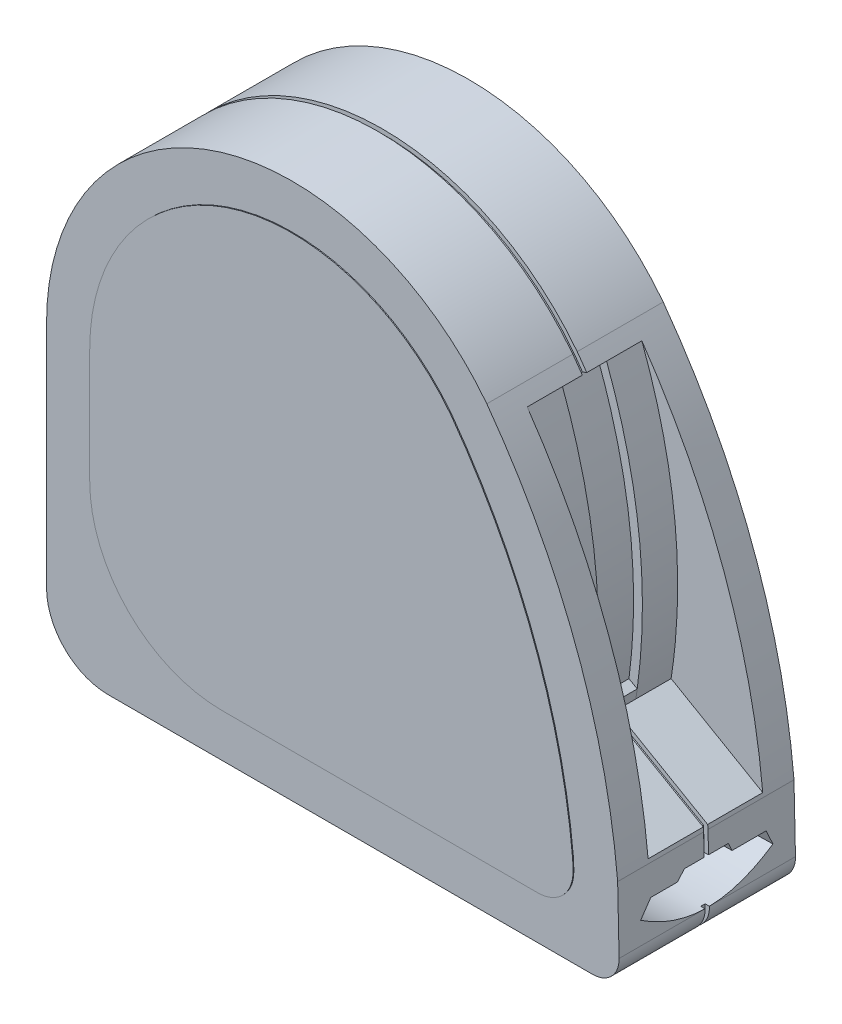
from build123d import *

# Parameters (mm, degrees)
BOSS_EXTRUDE1_DEPTH = 20
CUT_EXTRUDE1_START  = -10
CUT_EXTRUDE1_DEPTH  = 10
SKETCH3_R           = 1
BOSS_EXTRUDE2_DEPTH = 11
CUT_EXTRUDE2_DEPTH  = 48
CUT_EXTRUDE3_START  = -4
CUT_EXTRUDE3_DEPTH  = 4
CUT_EXTRUDE4_START  = -5
CUT_EXTRUDE4_DEPTH  = 5
CUT_EXTRUDE5_START  = -4
CUT_EXTRUDE5_DEPTH  = 4
CUT_EXTRUDE6_START  = -0.5
CUT_EXTRUDE6_DEPTH  = 0.5
SKETCH10_W          = 11.881943506
SKETCH10_H          = 0.5
CUT_EXTRUDE8_DEPTH  = 0.5
SKETCH13_R          = 2.5
BOSS_EXTRUDE4_DEPTH = 0.5
CUT_EXTRUDE11_DEPTH = 0.5
FILLET1_R           = 4.5
BOSS_EXTRUDE6_DEPTH = 0.25
BOSS_EXTRUDE7_DEPTH = 0.1


with BuildPart() as part:
    # Sketch1 → Boss-Extrude1 (new body)
    with BuildSketch(Plane.XY):
        with BuildLine():
            Line((-3.067227503, 0), (-58, 0))
            ThreePointArc((-58, 0), (-62.949747468, 2.050252532), (-65, 7))
            Line((-65, 7), (-65, 33))
            ThreePointArc((-65, 33), (-46.129115171, 59.379890402), (-15.068017417, 50.040879846))
            ThreePointArc((-15.068017417, 50.040879846), (-4.964589361, 31.296635474), (-0.233494874, 10.535067603))
            Line((-0.233494874, 10.535067603), (-0.067964069, 3.066474432))
            ThreePointArc((-0.067964069, 3.066474432), (-0.922533668, 0.902313572), (-3.067227503, 0))
        make_face()
    extrude(amount=BOSS_EXTRUDE1_DEPTH)

    # Sketch2 → Cut-Extrude1 (cut)
    with BuildSketch(Plane.XY.offset(15).offset(CUT_EXTRUDE1_START)):
        with BuildLine():
            Line((-62, 7), (-65, 7))
            ThreePointArc((-65, 7), (-62.949747468, 2.050252532), (-58, 0))
            Line((-58, 0), (-58, 3))
            ThreePointArc((-58, 3), (-60.828427125, 4.171572875), (-62, 7))
        make_face()
    extrude(amount=CUT_EXTRUDE1_DEPTH, mode=Mode.SUBTRACT)

    # Sketch3 → Boss-Extrude2 (add)
    with BuildSketch(Plane.XY.offset(5)):
        with Locations((-61.889087297, 3.110912703)):
            Circle(SKETCH3_R)
    extrude(amount=BOSS_EXTRUDE2_DEPTH)

    # Sketch4 → Cut-Extrude2 (cut)
    with BuildSketch(Plane(origin=(0, 0, 0), x_dir=(0, 0, -1), z_dir=(0.9997544781853775, 0.02215814406225341, 0))):
        with BuildLine():
            Line((-16.31638175, 7.173372755), (-13.277275607, 7.173372755))
            Line((-13.277275607, 7.173372755), (-12.5, 8.067227503))
            Line((-12.5, 8.067227503), (-7.5, 8.067227503))
            Line((-7.5, 8.067227503), (-7.097765363, 7.173372755))
            Line((-7.097765363, 7.173372755), (-3.237538434, 7.173372755))
            Line((-3.237538434, 7.173372755), (-2.5, 5.534398458))
            add(Edge.make_bspline(
                [(-2.5, 5.534398458), (-10, 0.600056549), (-17.5, 5.534398458)],
                knots=[0, 0, 0, 1, 1, 1], degree=2))
            Line((-17.5, 5.534398458), (-16.31638175, 7.173372755))
        make_face()
    extrude(amount=-CUT_EXTRUDE2_DEPTH, mode=Mode.SUBTRACT)

    # Sketch5 → Cut-Extrude3 (cut)
    with BuildSketch(Plane.XY.offset(16.5).offset(CUT_EXTRUDE3_START)):
        with BuildLine():
            Line((-10.668622774, 17), (-0.276317928, 11))
            ThreePointArc((-0.276317928, 11), (-4.721665164, 30.640901571), (-13.987593056, 48.520183068))
            add(Edge.make_bspline(
                [(-10.668622774, 17), (-8.185258464, 32.996979826), (-13.987593056, 48.520183068)],
                knots=[0, 0, 0, 0.998403777, 0.998403777, 0.998403777], degree=2))
        make_face()
    extrude(amount=CUT_EXTRUDE3_DEPTH, mode=Mode.SUBTRACT)

    # Sketch7 → Cut-Extrude4 (cut)
    with BuildSketch(Plane.XY.offset(12.5).offset(CUT_EXTRUDE4_START)):
        with BuildLine():
            Line((-13.987593056, 48.520183068), (-14.924295987, 48.17005792))
            add(Edge.make_bspline(
                [(-11.448620959, 18.605032701), (-10.822746073, 23.362936066), (-10.757337335, 28.083756583), (-11.79521716, 37.940476985), (-13.018097552, 43.07033379), (-14.924295987, 48.17005792)],
                knots=[0.046122426, 0.046122426, 0.046122426, 0.046122426, 0.5, 0.5, 1, 1, 1, 1], degree=3))
            Line((-11.448620959, 18.605032701), (-10.512464367, 18.064542441))
            add(Edge.make_bspline(
                [(-10.668622774, 17), (-10.585952463, 17.53253374), (-10.512464367, 18.064542441)],
                knots=[0, 0, 0, 1, 1, 1], degree=2))
            Line((-10.668622774, 17), (-0.902736822, 11.361663117))
            Line((-0.902736822, 11.361663117), (-0.276317928, 11))
            ThreePointArc((-0.276317928, 11), (-4.721665164, 30.640901571), (-13.987593056, 48.520183068))
        make_face()
    extrude(amount=CUT_EXTRUDE4_DEPTH, mode=Mode.SUBTRACT)

    # Sketch8 → Cut-Extrude5 (cut)
    with BuildSketch(Plane.XY.offset(7.5).offset(CUT_EXTRUDE5_START)):
        with BuildLine():
            Line((-0.276317928, 11), (-10.668622774, 17))
            add(Edge.make_bspline(
                [(-10.668622774, 17), (-8.185258464, 32.996979826), (-13.987593056, 48.520183068)],
                knots=[0, 0, 0, 1, 1, 1], degree=2))
            ThreePointArc((-13.987593056, 48.520183068), (-4.721665164, 30.640901571), (-0.276317928, 11))
        make_face()
    extrude(amount=CUT_EXTRUDE5_DEPTH, mode=Mode.SUBTRACT)

    # Sketch9 → Cut-Extrude6 (cut)
    with BuildSketch(Plane.XY.offset(10.25).offset(CUT_EXTRUDE6_START)):
        with BuildLine():
            Line((-65, 33), (-65, 7))
            ThreePointArc((-65, 7), (-62.949747468, 2.050252532), (-58, 0))
            Line((-58, 0), (-3.067227503, 0))
            ThreePointArc((-3.067227503, 0), (-0.922533668, 0.902313572), (-0.067964069, 3.066474432))
            Line((-0.067964069, 3.066474432), (-0.233494874, 10.535067603))
            ThreePointArc((-0.233494874, 10.535067603), (-4.964589361, 31.296635474), (-15.068017417, 50.040879846))
            ThreePointArc((-15.068017417, 50.040879846), (-46.129115171, 59.379890402), (-65, 33))
        make_face()
        with BuildLine():
            Line((-0.567841308, 3.05539536), (-0.733001722, 10.507276848))
            ThreePointArc((-0.733001722, 10.507276848), (-5.43436068, 31.125352083), (-15.468000097, 49.740772639))
            ThreePointArc((-15.468000097, 49.740772639), (-45.97095186, 58.905551929), (-64.5, 33))
            Line((-64.5, 33), (-64.5, 7))
            ThreePointArc((-64.5, 7), (-62.596194078, 2.403805922), (-58, 0.5))
            Line((-58, 0.5), (-3.067227503, 0.5))
            ThreePointArc((-3.067227503, 0.5), (-1.27998264, 1.251927976), (-0.567841308, 3.05539536))
        make_face(mode=Mode.SUBTRACT)
    extrude(amount=CUT_EXTRUDE6_DEPTH, mode=Mode.SUBTRACT)

    # Sketch10 → Cut-Extrude8 (cut)
    with BuildSketch(Plane(origin=(4.694060239, 8.130350827, 0), x_dir=(0.8660254037844382, -0.500000000000001, 0), z_dir=(0.5000000000000009, 0.866025403784438, 0))):
        with Locations((-11.798326593, -10)):
            Rectangle(SKETCH10_W, SKETCH10_H)
    extrude(amount=-CUT_EXTRUDE8_DEPTH, mode=Mode.SUBTRACT)

    # Sketch13 → Boss-Extrude4 (add)
    with BuildSketch(Plane(origin=(0, 0, 0), x_dir=(-1, 0, 0), z_dir=(0, 0, -1))):
        with Locations((9.223846096, 10)):
            Circle(SKETCH13_R)
        with Locations((59.223846096, 10)):
            Circle(SKETCH13_R)
    extrude(amount=BOSS_EXTRUDE4_DEPTH)

    # Sketch14 → Cut-Extrude11 (cut)
    with BuildSketch(Plane(origin=(0, 0, -0.5), x_dir=(-1, 0, 0), z_dir=(0, 0, -1))):
        Polygon((8.973846096, 11.75), (9.473846096, 11.75), (9.473846096, 10.25), (10.973846096, 10.25), (10.973846096, 9.75), (9.473846096, 9.75), (9.473846096, 8.25), (8.973846096, 8.25), (8.973846096, 9.75), (7.473846096, 9.75), (7.473846096, 10.25), (8.973846096, 10.25), align=None)
        Polygon((60.973846096, 9.75), (59.473846096, 9.75), (59.473846096, 8.25), (58.973846096, 8.25), (58.973846096, 9.75), (57.473846096, 9.75), (57.473846096, 10.25), (58.973846096, 10.25), (58.973846096, 11.75), (59.473846096, 11.75), (59.473846096, 10.25), (60.973846096, 10.25), align=None)
    extrude(amount=-CUT_EXTRUDE11_DEPTH, mode=Mode.SUBTRACT)

    # Fillet1
    # the kernel refuses this fillet: 4.5 mm, written as the material it takes off along each edge
    with BuildSketch(Plane(origin=(-59.223846096, 10, -0.5), x_dir=(-1, 0, 0), z_dir=(0, -1, 0))) as fillet1_piece_1:
        with BuildLine():
            CenterArc((0.438447187, -4.5), FILLET1_R, 62.733955549, 27.266044451)
            Line((0.438447187, 0), (0.438447187, 0.09))
            Line((0.438447187, 0.09), (2.5, 0.09))
            Line((2.5, 0.09), (2.59, 0))
            ThreePointArc((2.59, 0), (2.59, -0.25), (2.541231056, -0.42))
            Line((2.541231056, -0.42), (2.5, -0.5))
        make_face()
    revolve(axis=Axis((-59.223846096, 10, -0.5), (0, 0, -1)), mode=Mode.SUBTRACT)
    with BuildSketch(Plane(origin=(-9.223846096, 10, -0.5), x_dir=(-1, 0, 0), z_dir=(0, -1, 0))) as fillet1_piece_2:
        with BuildLine():
            CenterArc((0.438447187, -4.5), FILLET1_R, 62.733955549, 27.266044451)
            Line((0.438447187, 0), (0.438447187, 0.09))
            Line((0.438447187, 0.09), (2.5, 0.09))
            Line((2.5, 0.09), (2.59, 0))
            ThreePointArc((2.59, 0), (2.59, -0.25), (2.541231056, -0.42))
            Line((2.541231056, -0.42), (2.5, -0.5))
        make_face()
    revolve(axis=Axis((-9.223846096, 10, -0.5), (0, 0, -1)), mode=Mode.SUBTRACT)

    # Sketch18 → Boss-Extrude6 (add)
    with BuildSketch(Plane(origin=(0, 0, 0), x_dir=(-1, 0, 0), z_dir=(0, 0, -1))):
        Polygon((26, 45.13), (26, 22), (47, 22), (47, 45.13), (47.5, 45.13), (47.5, 21.5), (25.5, 21.5), (25.5, 45.13), align=None)
    extrude(amount=BOSS_EXTRUDE6_DEPTH)

    # Sketch12 → Boss-Extrude7 (add)
    with BuildSketch(Plane.XY.offset(20)):
        with BuildLine():
            Line((-60, 33), (-60, 20))
            ThreePointArc((-60, 20), (-55.606601718, 9.393398282), (-45, 5))
            Line((-45, 5), (-9.20168251, 5))
            ThreePointArc((-9.20168251, 5), (-6.34209073, 6.203084762), (-5.202664598, 9.088632576))
            Line((-5.202664598, 9.088632576), (-5.228508731, 10.254695422))
            ThreePointArc((-5.228508731, 10.254695422), (-9.661507865, 29.581649412), (-19.066617415, 47.038067892))
            ThreePointArc((-19.066617415, 47.038067892), (-44.546468157, 54.63682717), (-60, 33))
        make_face()
    extrude(amount=BOSS_EXTRUDE7_DEPTH)


solid = part.part
